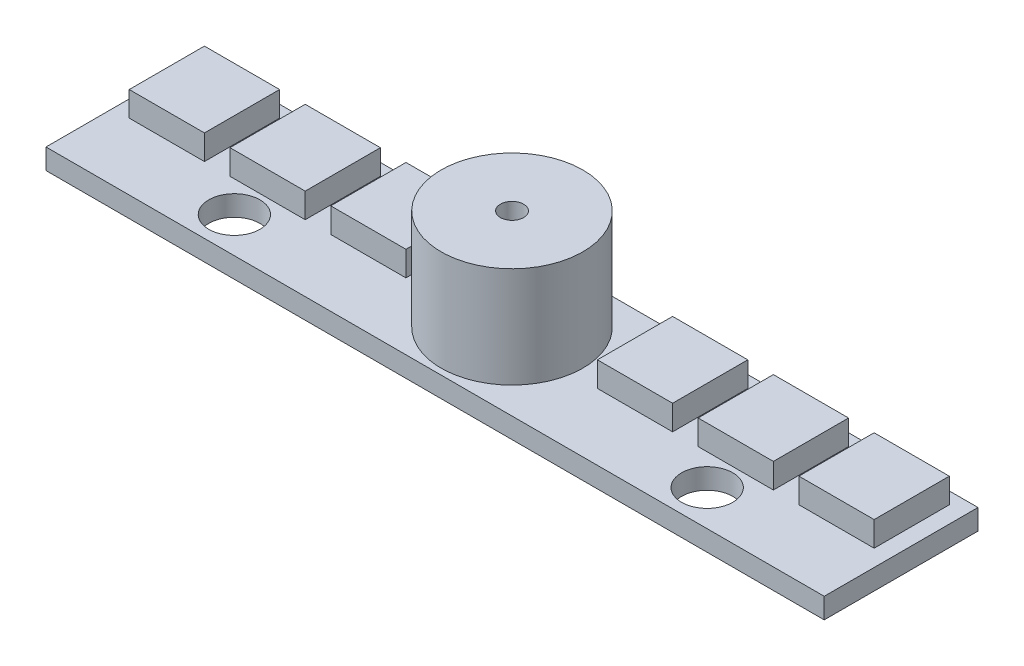
from build123d import *

# Parameters (mm, degrees)
SKETCH1_W           = 50.2
SKETCH1_H           = 9.92
SKETCH1_R           = 1.65
BOSS_EXTRUDE1_DEPTH = 1.32
SKETCH2_R           = 4.575
BOSS_EXTRUDE2_DEPTH = 6.5
SKETCH3_R           = 0.75
CUT_EXTRUDE1_DEPTH  = 1.5
SKETCH4_W           = 4.85
SKETCH4_H           = 4.85
BOSS_EXTRUDE3_DEPTH = 1.6


with BuildPart() as part:
    # Sketch1 → Boss-Extrude1 (new body)
    with BuildSketch(Plane(origin=(0, 0, 0), x_dir=(1, 0, 0), z_dir=(0, 1, 0))):
        Rectangle(SKETCH1_W, SKETCH1_H)
        with Locations((-15.25, -2.66)):
            Circle(SKETCH1_R, mode=Mode.SUBTRACT)
        with Locations((15.25, -2.66)):
            Circle(SKETCH1_R, mode=Mode.SUBTRACT)
    extrude(amount=BOSS_EXTRUDE1_DEPTH)

    # Sketch2 → Boss-Extrude2 (add)
    with BuildSketch(Plane(origin=(0, 1.32, 0), x_dir=(1, 0, 0), z_dir=(0, 1, 0))):
        Circle(SKETCH2_R)
    extrude(amount=BOSS_EXTRUDE2_DEPTH)

    # Sketch3 → Cut-Extrude1 (cut)
    with BuildSketch(Plane(origin=(0, 7.82, 0), x_dir=(1, 0, 0), z_dir=(0, 1, 0))):
        Circle(SKETCH3_R)
    extrude(amount=-CUT_EXTRUDE1_DEPTH, mode=Mode.SUBTRACT)

    # Sketch4 → Boss-Extrude3 (add)
    with BuildSketch(Plane(origin=(0, 1.32, 0), x_dir=(1, 0, 0), z_dir=(0, 1, 0))):
        with Locations((-8.6, 1.76)):
            Rectangle(SKETCH4_W, SKETCH4_H)
        with Locations((-15.1, 1.76)):
            Rectangle(SKETCH4_W, SKETCH4_H)
        with Locations((-21.6, 1.76)):
            Rectangle(SKETCH4_W, SKETCH4_H)
        with Locations((8.6, 1.76)):
            Rectangle(SKETCH4_W, SKETCH4_H)
        with Locations((15.1, 1.76)):
            Rectangle(SKETCH4_W, SKETCH4_H)
        with Locations((21.6, 1.76)):
            Rectangle(SKETCH4_W, SKETCH4_H)
    extrude(amount=BOSS_EXTRUDE3_DEPTH)


solid = part.part
